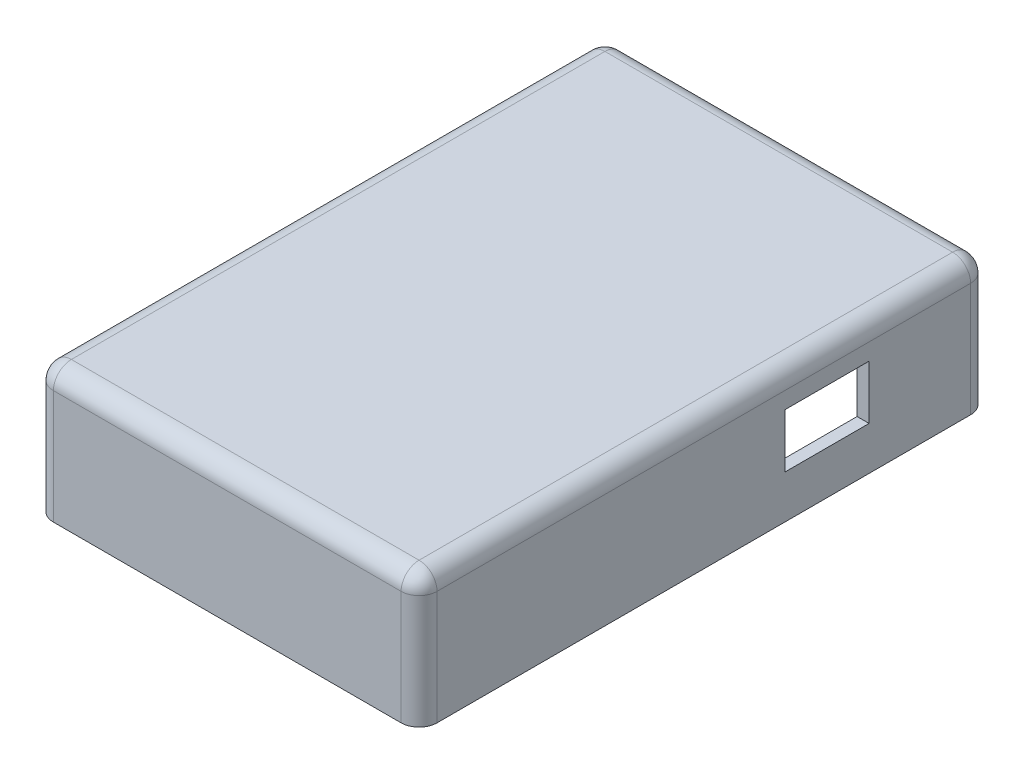
from build123d import *

# Parameters (mm, degrees)
SKETCH1_W           = 64
SKETCH1_H           = 95
BOSS_EXTRUDE1_DEPTH = 2
BOSS_EXTRUDE2_DEPTH = 20
CUT_EXTRUDE1_DEPTH  = 1.5
FILLET1_R           = 10
SKETCH3_R           = 3.0000000000000004
SKETCH3_R_2         = 1.2500000000000013
SKETCH3_R_3         = 3.000000000000001
SKETCH3_R_4         = 1.2500000000000009
BOSS_EXTRUDE3_DEPTH = 3
CUT_EXTRUDE3_REACH  = 84.172
CUT_EXTRUDE4_REACH  = 84.172
SKETCH10_R          = 1.4999999999999996
CUT_EXTRUDE5_REACH  = 104.22
SKETCH11_R          = 4
BOSS_EXTRUDE4_DEPTH = 20
SKETCH15_W          = 35.50000000000001
SKETCH15_H          = 3.499999999999986
BOSS_EXTRUDE5_DEPTH = 11
CUT_EXTRUDE6_DEPTH  = 9
CHAMFER4_SIZE       = 4.2
SKETCH18_R          = 4.999999999999999
SKETCH18_R_2        = 1.2500000000000013
SKETCH18_R_3        = 1.2500000000000113
BOSS_EXTRUDE6_DEPTH = 18.5
CUT_EXTRUDE7_REACH  = 84.172
FILLET2_R           = 3
FILLET3_R           = 3
SKETCH20_W          = 3.0000000000000036
SKETCH20_H          = 2.4299999999999855
SKETCH20_W_2        = 2.9999999999999964
SKETCH20_H_2        = 2.4299999999999926
BOSS_EXTRUDE7_DEPTH = 18.5
FILLET6_R           = 1
FILLET7_R           = 2


with BuildPart() as part:
    # Sketch1 → Boss-Extrude1 (new body)
    with BuildSketch(Plane(origin=(0, 0, 0), x_dir=(1, 0, 0), z_dir=(0, 1, 0))):
        Rectangle(SKETCH1_W, SKETCH1_H)
    extrude(amount=BOSS_EXTRUDE1_DEPTH)

    # 3DSketch3 → Boss-Extrude2 (add)
    with BuildSketch(Plane(origin=(-29.999999999999986, 0, 45.49999999999999), x_dir=(0.554700196225229, 0, -0.8320502943378437), z_dir=(0, 1, 0))):
        Polygon((-2.7735009811261575, 0.5547001962252318), (76.27127698096902, 53.251218837622), (111.77208953938367, 0), (32.727311577288496, -52.69651864139676), align=None)
        Polygon((0, 0), (75.71657678474375, 50.47771785649584), (108.9985885582575, 0.554700196225201), (33.28201177351374, -49.923017660270624), align=None, mode=Mode.SUBTRACT)
    extrude(amount=-BOSS_EXTRUDE2_DEPTH)

    # Sketch2 → Cut-Extrude1 (cut)
    with BuildSketch(Plane.XZ.offset(20)):
        Polygon((31, 46.50000000000001), (-30.999999999999993, 46.50000000000001), (-30.999999999999993, -46.50000000000001), (31.000000000000007, -46.50000000000001), align=None)
    extrude(amount=-CUT_EXTRUDE1_DEPTH, mode=Mode.SUBTRACT)

    # Fillet1
    fillet1_edges = [part.edges().sort_by_distance(p)[0] for p in [
        (30.000000000000014, -9.25, -45.49999999999998),
        (-30, -9.25, -45.49999999999998),
        (30.000000000000007, -9.25, 45.5),
        (-29.999999999999986, -9.25, 45.49999999999999),
    ]]
    fillet(fillet1_edges, radius=FILLET1_R)

    # Sketch3 → Boss-Extrude3 (add)
    # profile 1 of 4: a face of its own
    with BuildSketch(Plane.XZ):
        with Locations(Location((-26.500000000000004, 24.500000000000004, 0), (0, 0, 270))):
            Circle(SKETCH3_R)
        with Locations(Location((-26.500000000000004, 24.500000000000004, 0), (0, 0, 270))):
            Circle(SKETCH3_R_2, mode=Mode.SUBTRACT)
    # profile 2 of 4: a face of its own
    with BuildSketch(Plane.XZ):
        with Locations(Location((26.499999999999996, 24.5, 0), (0, 0, 270))):
            Circle(SKETCH3_R)
        with Locations(Location((26.499999999999996, 24.5, 0), (0, 0, 270))):
            Circle(SKETCH3_R_2, mode=Mode.SUBTRACT)
    # profile 3 of 4: a face of its own
    with BuildSketch(Plane.XZ):
        with Locations(Location((26.500000000000004, -4.499999999999999, 0), (0, 0, 270))):
            Circle(SKETCH3_R_3)
        with Locations(Location((26.500000000000004, -4.499999999999999, 0), (0, 0, 270))):
            Circle(SKETCH3_R_4, mode=Mode.SUBTRACT)
    # profile 4 of 4: a face of its own
    with BuildSketch(Plane.XZ):
        with Locations(Location((-26.500000000000004, -4.499999999999999, 0), (0, 0, 270))):
            Circle(SKETCH3_R_3)
        with Locations(Location((-26.500000000000004, -4.499999999999999, 0), (0, 0, 270))):
            Circle(SKETCH3_R_4, mode=Mode.SUBTRACT)
    extrude(amount=BOSS_EXTRUDE3_DEPTH)

    # Sketch9 → Cut-Extrude3 (cut, up to next)
    with BuildSketch(Plane.ZY.offset(31.999999999999993), mode=Mode.PRIVATE) as cut_extrude3_sk1:
        with BuildLine():
            Line((14.734857240872076, -20), (14.734857240872076, -18.222842712535012))
            ThreePointArc((14.734857240872076, -18.222842712535012), (14.658736773383362, -17.840159280169924), (14.441964022058624, -17.51573593134847))
            Line((14.441964022058624, -17.51573593134847), (13.809121309524503, -16.882893218814356))
            ThreePointArc((13.809121309524503, -16.882893218814356), (13.484697960703047, -16.666120467489616), (13.102014528337957, -16.5900000000009))
            Line((13.102014528337957, -16.5900000000009), (7.99196401996333, -16.5900000000009))
            ThreePointArc((7.99196401996333, -16.5900000000009), (7.609280587197636, -16.666120467655695), (7.284857238163581, -16.882893219427746))
            Line((7.284857238163581, -16.882893219427746), (6.527750459072318, -17.63999999983213))
            ThreePointArc((6.527750459072318, -17.63999999983213), (6.310977708194816, -17.964423348440974), (6.234857240871916, -18.34710678040548))
            Line((6.234857240871916, -18.34710678040548), (6.234857240871916, -20))
            Line((6.234857240871916, -20), (14.734857240872076, -20))
        make_face()
    cut_extrude3_tool1 = extrude(cut_extrude3_sk1.sketch, amount=-CUT_EXTRUDE3_REACH, mode=Mode.PRIVATE) & part.part
    add(cut_extrude3_tool1.solids().sort_by_distance((-32, -18.37521, 10.505834))[0], mode=Mode.SUBTRACT)

    # Sketch10 → Cut-Extrude4 (cut, up to next)
    with BuildSketch(Plane.ZY.offset(31.999999999999993), mode=Mode.PRIVATE) as cut_extrude4_sk1:
        with Locations((1.2, -10)):
            Circle(SKETCH10_R)
    cut_extrude4_tool1 = extrude(cut_extrude4_sk1.sketch, amount=-CUT_EXTRUDE4_REACH, mode=Mode.PRIVATE) & part.part
    add(cut_extrude4_tool1.solids().sort_by_distance((-32, -10, 1.2))[0], mode=Mode.SUBTRACT)

    # Sketch11 → Cut-Extrude5 (cut, up to next)
    with BuildSketch(Plane(origin=(0, 0, -47.5), x_dir=(-1, 0, 0), z_dir=(0, 0, -1)), mode=Mode.PRIVATE) as cut_extrude5_sk1:
        with Locations((-6.94e-15, -20)):
            Circle(SKETCH11_R)
    cut_extrude5_tool1 = extrude(cut_extrude5_sk1.sketch, amount=-CUT_EXTRUDE5_REACH, mode=Mode.PRIVATE) & part.part
    add(cut_extrude5_tool1.solids().sort_by_distance((0, -20, -47.5))[0], mode=Mode.SUBTRACT)

    # Sketch13 → Boss-Extrude4 (add)
    with BuildSketch(Plane.XZ):
        Polygon((15.250000000000018, -43.06999999999999), (-25.249999999999986, -43.07), (-25.249999999999986, -34.56999999999999), (15.250000000000018, -34.56999999999999), align=None)
        Polygon((12.750000000000016, -40.569999999999986), (12.750000000000016, -37.06999999999999), (-22.74999999999999, -37.07), (-22.74999999999999, -40.569999999999986), align=None, mode=Mode.SUBTRACT)
    extrude(amount=BOSS_EXTRUDE4_DEPTH)

    # Sketch15 → Boss-Extrude5 (add)
    with BuildSketch(Plane.XZ):
        with Locations((-4.999999999999987, -38.81999999999999)):
            Rectangle(SKETCH15_W, SKETCH15_H)
    extrude(amount=BOSS_EXTRUDE5_DEPTH)

    # Sketch17 → Cut-Extrude6 (cut)
    with BuildSketch(Plane.XY.offset(-34.56999999999999)):
        Polygon((4.7500000000000115, -20), (-15.24999999999999, -20.000000000000004), (-15.24999999999999, -15.5), (4.7500000000000115, -15.5), align=None)
    extrude(amount=-CUT_EXTRUDE6_DEPTH, mode=Mode.SUBTRACT)

    # Chamfer4
    chamfer4_edges = [part.edges().sort_by_distance(p)[0] for p in [
        (-15.249999999999984, -20.000000000000004, -35.81999999999999),
    ]]
    chamfer(chamfer4_edges, length=CHAMFER4_SIZE)

    # Sketch18 → Boss-Extrude6 (add)
    # profile 1 of 2: a face of its own
    with BuildSketch(Plane.XZ):
        with Locations((25.65752160816483, -41.15752160816483)):
            Circle(SKETCH18_R)
        with Locations(Location((25.65752160816483, -41.15752160816483, 0), (0, 0, 270))):
            Circle(SKETCH18_R_2, mode=Mode.SUBTRACT)
    # profile 2 of 2: a face of its own
    with BuildSketch(Plane.XZ):
        with Locations((-25.657521608164807, 41.15752160816483)):
            Circle(SKETCH18_R)
        with Locations(Location((-25.657521608164807, 41.15752160816483, 0), (0, 0, 270))):
            Circle(SKETCH18_R_3, mode=Mode.SUBTRACT)
    extrude(amount=BOSS_EXTRUDE6_DEPTH)

    # Sketch19 → Cut-Extrude7 (cut, up to next)
    with BuildSketch(Plane(origin=(32.00000000000001, 0, 0), x_dir=(0, 0, -1), z_dir=(1, 0, 0)), mode=Mode.PRIVATE) as cut_extrude7_sk1:
        Polygon((27.565006511475303, -12.776632247834925), (13.565006511475303, -12.776632247834925), (13.565006511475303, -3.7766322478349266), (27.565006511475303, -3.776632247834925), align=None)
    cut_extrude7_tool1 = extrude(cut_extrude7_sk1.sketch, amount=-CUT_EXTRUDE7_REACH, mode=Mode.PRIVATE) & part.part
    add(cut_extrude7_tool1.solids().sort_by_distance((32, -8.276632, -20.565007))[0], mode=Mode.SUBTRACT)

    # Fillet2
    fillet2_edges = [part.edges().sort_by_distance(p)[0] for p in [
        (32, -9, 47.5),
        (-31.999999999999993, -9, 47.5),
        (-31.999999999999993, -9, -47.500000000000014),
        (32.00000000000001, -9, -47.5),
    ]]
    fillet(fillet2_edges, radius=FILLET2_R)

    # Fillet3
    fillet3_edges = [part.edges().sort_by_distance(p)[0] for p in [
        (32.00000000000001, 2, 0),
        (1.421e-14, 2, 47.5),
        (7.11e-15, 2, -47.5),
        (-31.999999999999993, 2, 0),
        (31.121320343559645, 2.000000000000001, -46.62132034355964),
        (-31.121320343559635, 2.000000000000002, -46.621320343559645),
        (-31.121320343559635, 2, 46.621320343559645),
        (31.121320343559663, 1.9999999999999987, 46.621320343559645),
    ]]
    fillet(fillet3_edges, radius=FILLET3_R)

    # Sketch20 → Boss-Extrude7 (add)
    with BuildSketch(Plane.XZ):
        with Locations((11.500000000000018, -44.285)):
            Rectangle(SKETCH20_W, SKETCH20_H)
        with Locations((-18.749999999999986, -44.285)):
            Rectangle(SKETCH20_W_2, SKETCH20_H_2)
    extrude(amount=BOSS_EXTRUDE7_DEPTH)

    # Fillet6
    fillet6_edges = [part.edges().sort_by_distance(p)[0] for p in [
        (10.000000000000016, -9.25, -43.07),
        (13.000000000000018, -9.25, -43.07),
        (-20.249999999999982, -9.25, -43.07),
        (-17.249999999999986, -9.25, -43.07),
    ]]
    fillet(fillet6_edges, radius=FILLET6_R)

    # Fillet7
    # the kernel refuses this fillet: 2 mm, written as the material it adds along each edge
    with BuildSketch(Plane(origin=(15.250000000000018, 0, -34.56999999999999), x_dir=(1, 0, 0), z_dir=(0, 0, -1))) as fillet7_piece_1:
        with BuildLine():
            CenterArc((FILLET7_R, FILLET7_R), FILLET7_R, 180, 90)
            Line((0, FILLET7_R), (-FILLET7_R * 0.02, FILLET7_R))
            Line((-FILLET7_R * 0.02, FILLET7_R), (-FILLET7_R * 0.02, -FILLET7_R * 0.02))
            Line((-FILLET7_R * 0.02, -FILLET7_R * 0.02), (FILLET7_R, -FILLET7_R * 0.02))
            Line((FILLET7_R, -FILLET7_R * 0.02), (FILLET7_R, 0))
        make_face()
    extrude(amount=8.5)
    with BuildSketch(Plane(origin=(-25.249999999999986, 0, -34.56999999999999), x_dir=(0, 0, 1), z_dir=(1, 0, 0))) as fillet7_piece_2:
        with BuildLine():
            CenterArc((FILLET7_R, FILLET7_R), FILLET7_R, 180, 90)
            Line((0, FILLET7_R), (-FILLET7_R * 0.02, FILLET7_R))
            Line((-FILLET7_R * 0.02, FILLET7_R), (-FILLET7_R * 0.02, -FILLET7_R * 0.02))
            Line((-FILLET7_R * 0.02, -FILLET7_R * 0.02), (FILLET7_R, -FILLET7_R * 0.02))
            Line((FILLET7_R, -FILLET7_R * 0.02), (FILLET7_R, 0))
        make_face()
    extrude(amount=40.5)
    with BuildSketch(Plane(origin=(-25.249999999999986, 0, -43.07), x_dir=(-1, 0, 0), z_dir=(0, 0, 1))) as fillet7_piece_3:
        with BuildLine():
            CenterArc((FILLET7_R, FILLET7_R), FILLET7_R, 180, 90)
            Line((0, FILLET7_R), (-FILLET7_R * 0.02, FILLET7_R))
            Line((-FILLET7_R * 0.02, FILLET7_R), (-FILLET7_R * 0.02, -FILLET7_R * 0.02))
            Line((-FILLET7_R * 0.02, -FILLET7_R * 0.02), (FILLET7_R, -FILLET7_R * 0.02))
            Line((FILLET7_R, -FILLET7_R * 0.02), (FILLET7_R, 0))
        make_face()
    extrude(amount=8.500000000000007)
    with BuildSketch(Plane(origin=(-25.249999999999986, 0, -34.56999999999999), x_dir=(0, 0, 1), z_dir=(1, 0, 0))) as fillet7_piece_4a_section:
        with BuildLine():
            CenterArc((FILLET7_R, FILLET7_R), FILLET7_R, 180, 90)
            Line((0, FILLET7_R), (-FILLET7_R * 0.02, FILLET7_R))
            Line((-FILLET7_R * 0.02, FILLET7_R), (-FILLET7_R * 0.02, -FILLET7_R * 0.02))
            Line((-FILLET7_R * 0.02, -FILLET7_R * 0.02), (FILLET7_R, -FILLET7_R * 0.02))
            Line((FILLET7_R, -FILLET7_R * 0.02), (FILLET7_R, 0))
        make_face()
    fillet7_piece_4a = extrude(amount=45.50000000000001, mode=Mode.PRIVATE)
    fillet7_piece_4a = split(fillet7_piece_4a, bisect_by=Plane(origin=(15.250000000000018, -0.4527902285336496, -34.11720977146634), z_dir=(1, 0, 0)), keep=Keep.TOP, mode=Mode.PRIVATE)
    with BuildSketch(Plane(origin=(15.250000000000018, 0, -29.569999999999993), x_dir=(1, 0, 0), z_dir=(0, 0, -1))) as fillet7_piece_4b_section:
        with BuildLine():
            CenterArc((FILLET7_R, FILLET7_R), FILLET7_R, 180, 90)
            Line((0, FILLET7_R), (-FILLET7_R * 0.02, FILLET7_R))
            Line((-FILLET7_R * 0.02, FILLET7_R), (-FILLET7_R * 0.02, -FILLET7_R * 0.02))
            Line((-FILLET7_R * 0.02, -FILLET7_R * 0.02), (FILLET7_R, -FILLET7_R * 0.02))
            Line((FILLET7_R, -FILLET7_R * 0.02), (FILLET7_R, 0))
        make_face()
    fillet7_piece_4b = extrude(amount=13.5, mode=Mode.PRIVATE)
    fillet7_piece_4b = split(fillet7_piece_4b, bisect_by=Plane(origin=(15.702790228533665, -0.45279022853364864, -34.56999999999999), z_dir=(0, 0, 1)), keep=Keep.TOP, mode=Mode.PRIVATE)
    fillet7_piece_4 = fillet7_piece_4a & fillet7_piece_4b
    add(fillet7_piece_4)
    with BuildSketch(Plane(origin=(-25.249999999999986, 0, -43.07), x_dir=(-1, 0, 0), z_dir=(0, 0, 1))) as fillet7_piece_5a_section:
        with BuildLine():
            CenterArc((FILLET7_R, FILLET7_R), FILLET7_R, 180, 90)
            Line((0, FILLET7_R), (-FILLET7_R * 0.02, FILLET7_R))
            Line((-FILLET7_R * 0.02, FILLET7_R), (-FILLET7_R * 0.02, -FILLET7_R * 0.02))
            Line((-FILLET7_R * 0.02, -FILLET7_R * 0.02), (FILLET7_R, -FILLET7_R * 0.02))
            Line((FILLET7_R, -FILLET7_R * 0.02), (FILLET7_R, 0))
        make_face()
    fillet7_piece_5a = extrude(amount=13.500000000000007, mode=Mode.PRIVATE)
    fillet7_piece_5a = split(fillet7_piece_5a, bisect_by=Plane(origin=(-25.702790228533637, -0.4527902285336497, -34.56999999999999), z_dir=(0, 0, 1)), keep=Keep.TOP, mode=Mode.PRIVATE)
    with BuildSketch(Plane(origin=(-30.249999999999986, 0, -34.56999999999999), x_dir=(0, 0, 1), z_dir=(1, 0, 0))) as fillet7_piece_5b_section:
        with BuildLine():
            CenterArc((FILLET7_R, FILLET7_R), FILLET7_R, 180, 90)
            Line((0, FILLET7_R), (-FILLET7_R * 0.02, FILLET7_R))
            Line((-FILLET7_R * 0.02, FILLET7_R), (-FILLET7_R * 0.02, -FILLET7_R * 0.02))
            Line((-FILLET7_R * 0.02, -FILLET7_R * 0.02), (FILLET7_R, -FILLET7_R * 0.02))
            Line((FILLET7_R, -FILLET7_R * 0.02), (FILLET7_R, 0))
        make_face()
    fillet7_piece_5b = extrude(amount=45.5, mode=Mode.PRIVATE)
    fillet7_piece_5b = split(fillet7_piece_5b, bisect_by=Plane(origin=(-25.249999999999986, -0.4527902285336496, -34.11720977146634), z_dir=(-1, 0, 0)), keep=Keep.TOP, mode=Mode.PRIVATE)
    fillet7_piece_5 = fillet7_piece_5a & fillet7_piece_5b
    add(fillet7_piece_5)


solid = part.part
